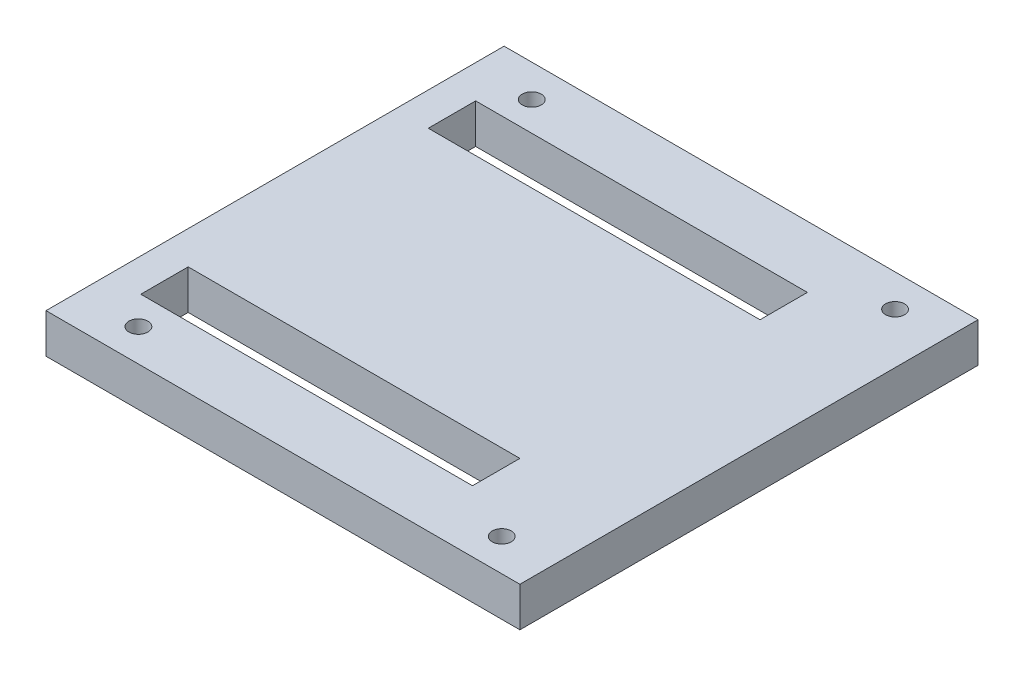
from build123d import *

# Parameters (mm, degrees)
SKETCH_1_W          = 30
SKETCH_1_H          = 29
SKETCH_1_W_2        = 21
SKETCH_1_H_2        = 3
EXTRUDE_1_DEPTH     = 2.5
SKETCH_2_R          = 0.6
CUT_EXTRUDE_1_DEPTH = 22.011901389
SKETCH_2_3_R        = 1
SKETCH_2_3_R_2      = 0.6
CUT_EXTRUDE_2_DEPTH = 1.5


with BuildPart() as part:
    # 草图1 → 凸台-拉伸1 (new body)
    with BuildSketch(Plane(origin=(0, 0, 0), x_dir=(1, 0, 0), z_dir=(0, 1, 0))):
        Rectangle(SKETCH_1_W, SKETCH_1_H)
        with Locations((-2.4, 9.1)):
            Rectangle(SKETCH_1_W_2, SKETCH_1_H_2, mode=Mode.SUBTRACT)
        with Locations((-2.4, -9.1)):
            Rectangle(SKETCH_1_W_2, SKETCH_1_H_2, mode=Mode.SUBTRACT)
    extrude(amount=EXTRUDE_1_DEPTH)

    # 草图2 → 切除-拉伸1 (cut, through all)
    with BuildSketch(Plane.XZ):
        with Locations((-11.2, -12.45)):
            Circle(SKETCH_2_R)
        with Locations((-11.2, 12.45)):
            Circle(SKETCH_2_R)
        with Locations((11.8, 12.45)):
            Circle(SKETCH_2_R)
        with Locations((11.8, -12.45)):
            Circle(SKETCH_2_R)
    extrude(amount=-CUT_EXTRUDE_1_DEPTH, mode=Mode.SUBTRACT)

    # 草图2<3> → 切除-拉伸2 (cut)
    # profile 1 of 4: a face of its own
    with BuildSketch(Plane.XZ):
        with Locations((-11.2, -12.45)):
            Circle(SKETCH_2_3_R)
        with Locations((-11.2, -12.45)):
            Circle(SKETCH_2_3_R_2, mode=Mode.SUBTRACT)
    # profile 2 of 4: a face of its own
    with BuildSketch(Plane.XZ):
        with Locations((-11.2, 12.45)):
            Circle(SKETCH_2_3_R)
        with Locations((-11.2, 12.45)):
            Circle(SKETCH_2_3_R_2, mode=Mode.SUBTRACT)
    # profile 3 of 4: a face of its own
    with BuildSketch(Plane.XZ):
        with Locations((11.8, 12.45)):
            Circle(SKETCH_2_3_R)
        with Locations((11.8, 12.45)):
            Circle(SKETCH_2_3_R_2, mode=Mode.SUBTRACT)
    # profile 4 of 4: a face of its own
    with BuildSketch(Plane.XZ):
        with Locations((11.8, -12.45)):
            Circle(SKETCH_2_3_R)
        with Locations((11.8, -12.45)):
            Circle(SKETCH_2_3_R_2, mode=Mode.SUBTRACT)
    extrude(amount=-CUT_EXTRUDE_2_DEPTH, mode=Mode.SUBTRACT)


solid = part.part
